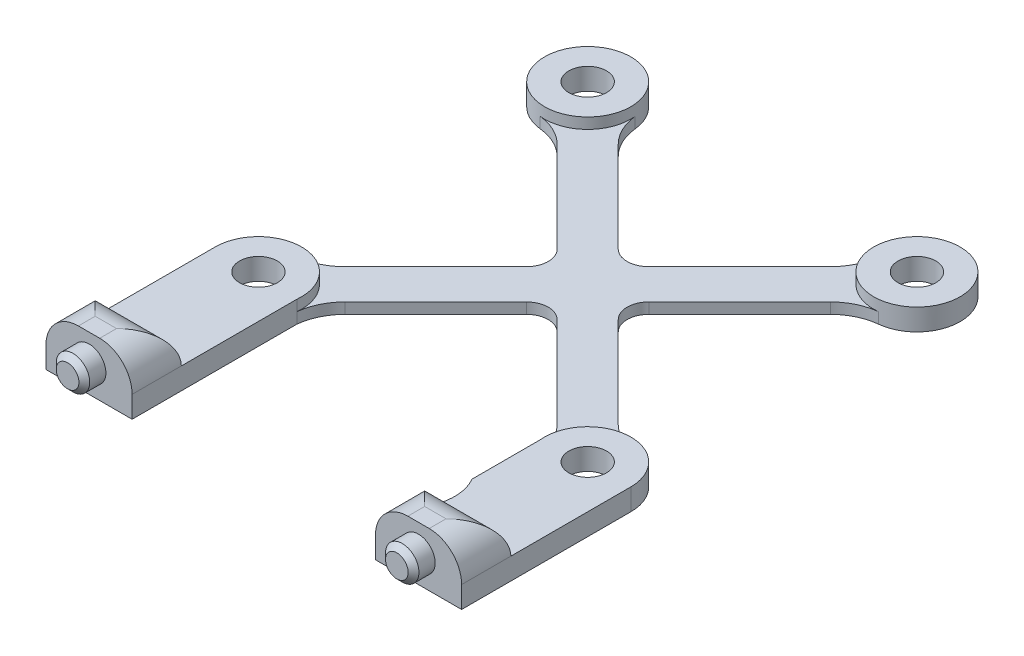
from build123d import *

# Parameters (mm, degrees)
SKETCH1_R           = 1.75
BOSS_EXTRUDE1_DEPTH = 1
SKETCH2_R           = 1.75
BOSS_EXTRUDE2_DEPTH = 1
FILLET1_R           = 5
FILLET2_R           = 2
BOSS_EXTRUDE3_REACH = 29.297
CUT_EXTRUDE1_REACH  = 38.486
SKETCH4_R           = 4.38
SKETCH5_W           = 7.977665541
SKETCH5_H           = 4.558516631
BOSS_EXTRUDE4_DEPTH = 3
SKETCH6_R           = 1.55
BOSS_EXTRUDE5_DEPTH = 2
FILLET3_R           = 3
CHAMFER1_SIZE       = 0.5


# Some blends are built 0.0001 mm under size
with BuildPart() as part:
    # Sketch1 → Boss-Extrude1 (new body)
    with BuildSketch(Plane(origin=(0, 0, 0), x_dir=(1, 0, 0), z_dir=(0, 1, 0))):
        with BuildLine():
            ThreePointArc((-11.386296695, 14.21472382), (-18.078427125, 18.078427125), (-14.21472382, 11.386296695))
            Line((-14.21472382, 11.386296695), (-2.828427125, 0))
            Line((-2.828427125, 0), (-14.21472382, -11.386296695))
            ThreePointArc((-14.21472382, -11.386296695), (-18.078427125, -18.078427125), (-11.386296695, -14.21472382))
            Line((-11.386296695, -14.21472382), (0, -2.828427125))
            Line((0, -2.828427125), (11.386296695, -14.21472382))
            ThreePointArc((11.386296695, -14.21472382), (18.078427125, -18.078427125), (14.21472382, -11.386296695))
            Line((14.21472382, -11.386296695), (2.828427125, 0))
            Line((2.828427125, 0), (14.21472382, 11.386296695))
            ThreePointArc((14.21472382, 11.386296695), (18.078427125, 18.078427125), (11.386296695, 14.21472382))
            Line((11.386296695, 14.21472382), (0, 2.828427125))
            Line((0, 2.828427125), (-11.386296695, 14.21472382))
        make_face()
        with Locations(Location((-15.25, -15.25, 0), (0, 0, 270))):
            Circle(SKETCH1_R, mode=Mode.SUBTRACT)
        with Locations(Location((15.25, -15.25, 0), (0, 0, 270))):
            Circle(SKETCH1_R, mode=Mode.SUBTRACT)
        with Locations(Location((-15.25, 15.25, 0), (0, 0, 270))):
            Circle(SKETCH1_R, mode=Mode.SUBTRACT)
        with Locations(Location((15.25, 15.25, 0), (0, 0, 270))):
            Circle(SKETCH1_R, mode=Mode.SUBTRACT)
    extrude(amount=BOSS_EXTRUDE1_DEPTH)

    # Sketch2 → Boss-Extrude2 (add)
    # profile 1 of 4: a face of its own
    with BuildSketch(Plane(origin=(0, 1, 0), x_dir=(1, 0, 0), z_dir=(0, 1, 0))):
        with BuildLine():
            ThreePointArc((-11.386296695, 14.21472382), (-11.284220555, 14.727895231), (-11.25, 15.25))
            ThreePointArc((-11.25, 15.25), (-18.423413361, 17.685045716), (-14.21472382, 11.386296695))
            ThreePointArc((-14.21472382, 11.386296695), (-12.421572875, 12.421572875), (-11.386296695, 14.21472382))
        make_face()
        with Locations(Location((-15.25, 15.25, 0), (0, 0, 270))):
            Circle(SKETCH2_R, mode=Mode.SUBTRACT)
    # profile 2 of 4: a face of its own
    with BuildSketch(Plane(origin=(0, 1, 0), x_dir=(1, 0, 0), z_dir=(0, 1, 0))):
        with BuildLine():
            ThreePointArc((-14.21472382, -11.386296695), (-18.423413361, -17.685045716), (-11.25, -15.25))
            ThreePointArc((-11.25, -15.25), (-11.284220555, -14.727895231), (-11.386296695, -14.21472382))
            ThreePointArc((-11.386296695, -14.21472382), (-12.421572875, -12.421572875), (-14.21472382, -11.386296695))
        make_face()
        with Locations(Location((-15.25, -15.25, 0), (0, 0, 270))):
            Circle(SKETCH2_R, mode=Mode.SUBTRACT)
    # profile 3 of 4: a face of its own
    with BuildSketch(Plane(origin=(0, 1, 0), x_dir=(1, 0, 0), z_dir=(0, 1, 0))):
        with BuildLine():
            ThreePointArc((11.386296695, -14.21472382), (14.727895231, -19.215779445), (19.25, -15.25))
            ThreePointArc((19.25, -15.25), (17.685045716, -12.076586639), (14.21472382, -11.386296695))
            ThreePointArc((14.21472382, -11.386296695), (12.421572875, -12.421572875), (11.386296695, -14.21472382))
        make_face()
        with Locations(Location((15.25, -15.25, 0), (0, 0, 270))):
            Circle(SKETCH2_R, mode=Mode.SUBTRACT)
    # profile 4 of 4: a face of its own
    with BuildSketch(Plane(origin=(0, 1, 0), x_dir=(1, 0, 0), z_dir=(0, 1, 0))):
        with BuildLine():
            ThreePointArc((14.21472382, 11.386296695), (17.685045716, 12.076586639), (19.25, 15.25))
            ThreePointArc((19.25, 15.25), (14.727895231, 19.215779445), (11.386296695, 14.21472382))
            ThreePointArc((11.386296695, 14.21472382), (12.421572875, 12.421572875), (14.21472382, 11.386296695))
        make_face()
        with Locations(Location((15.25, 15.25, 0), (0, 0, 270))):
            Circle(SKETCH2_R, mode=Mode.SUBTRACT)
    extrude(amount=BOSS_EXTRUDE2_DEPTH)

    # Fillet1
    # the kernel refuses this fillet: 5 mm, written as the material it adds along each edge
    with BuildSketch(Plane(origin=(-11.386296695, 0, -14.21472382), x_dir=(0.07795833957339635, 0, -0.9969566175571327), z_dir=(0, 1, 0))) as fillet1_piece_1:
        with BuildLine():
            CenterArc((2.375482021, -4.915816238), FILLET1_R, 100.528779366, 38.942441269)
            Line((-1.424916256, -1.666666667), (-1.500924222, -1.601683675))
            Line((-1.500924222, -1.601683675), (-0.076007966, 0.064982991))
            Line((-0.076007966, 0.064982991), (0.018272939, 0.098316325))
            ThreePointArc((0.018272939, 0.098316325), (0.730917545, 0.03265299), (1.443562151, 0.098316325))
            Line((1.443562151, 0.098316325), (1.46183509, 0))
        make_face()
    extrude(amount=1)
    with BuildSketch(Plane(origin=(11.386296695, 0, -14.21472382), x_dir=(-0.7071067811865598, 0, 0.7071067811865355), z_dir=(0, 1, 0))) as fillet1_piece_2:
        with BuildLine():
            CenterArc((2.192752634, -5), FILLET1_R, 90, 38.942441269)
            Line((-0.949944171, -1.111111111), (-1.012798107, -1.033333333))
            ThreePointArc((-1.012798107, -1.033333333), (-0.499790959, -0.534336666), (-0.08660254, 0.05))
            Line((-0.08660254, 0.05), (0, 0.1))
            Line((0, 0.1), (2.192752634, 0.1))
            Line((2.192752634, 0.1), (2.192752634, 0))
        make_face()
    extrude(amount=1)
    with BuildSketch(Plane(origin=(14.21472382, 0, -11.386296695), x_dir=(-0.7071067811865354, 0, 0.7071067811865597), z_dir=(0, 1, 0)), Plane(origin=(11.386296695, 0, 14.21472382), x_dir=(-0.7071067811865589, 0, -0.7071067811865362), z_dir=(0, 1, 0)), Plane(origin=(-14.21472382, 0, 11.386296695), x_dir=(0.707106781186535, 0, -0.7071067811865601), z_dir=(0, 1, 0))) as fillet1_piece_3:
        with BuildLine():
            CenterArc((2.192752634, 5), FILLET1_R, 231.057558731, 38.942441269)
            Line((-0.949944171, 1.111111111), (-1.012798107, 1.033333333))
            ThreePointArc((-1.012798107, 1.033333333), (-0.499790959, 0.534336666), (-0.08660254, -0.05))
            Line((-0.08660254, -0.05), (0, -0.1))
            Line((0, -0.1), (2.192752634, -0.1))
            Line((2.192752634, -0.1), (2.192752634, 0))
        make_face()
    extrude(amount=1)
    with BuildSketch(Plane(origin=(14.21472382, 0, 11.386296695), x_dir=(0.9969566175571322, 0, -0.07795833957340413), z_dir=(0, 1, 0)), Plane(origin=(-11.386296695, 0, 14.21472382), x_dir=(0.07795833957339876, 0, 0.9969566175571326), z_dir=(0, 1, 0)), Plane(origin=(-14.21472382, 0, -11.386296695), x_dir=(-0.9969566175571319, 0, 0.07795833957340663), z_dir=(0, 1, 0))) as fillet1_piece_4:
        with BuildLine():
            CenterArc((2.375482021, 4.915816238), FILLET1_R, 220.528779366, 38.942441269)
            Line((-1.424916256, 1.666666667), (-1.500924222, 1.601683675))
            Line((-1.500924222, 1.601683675), (-0.076007966, -0.064982991))
            Line((-0.076007966, -0.064982991), (0.018272939, -0.098316325))
            ThreePointArc((0.018272939, -0.098316325), (0.730917545, -0.03265299), (1.443562151, -0.098316325))
            Line((1.443562151, -0.098316325), (1.46183509, 0))
        make_face()
    extrude(amount=1)

    # Fillet2
    fillet2_edges = [part.edges().sort_by_distance(p)[0] for p in [
        (0, 0.5, -2.828427125),
        (2.828427125, 0.5, 0),
        (0, 0.5, 2.828427125),
        (-2.828427125, 0.5, 0),
    ]]
    fillet(fillet2_edges, radius=FILLET2_R)

    # Boss-Extrude3: up to this face of the body (flat: up to its plane)
    boss_extrude3_end = Plane(part.part.faces().sort_by_distance((11.363137085, 2, 15.25))[0])
    # Sketch3 → Boss-Extrude3 (add, up to the picked face)
    with BuildSketch(Plane.XZ, mode=Mode.PRIVATE) as boss_extrude3_sk1:
        with BuildLine():
            Line((-11.272334459, 30.93), (-19.25, 30.93))
            Line((-19.25, 30.93), (-19.25, 15.25))
            ThreePointArc((-19.25, 15.25), (-15.461350224, 19.244412483), (-11.272334459, 15.672109986))
            Line((-11.272334459, 15.672109986), (-11.272334459, 30.93))
        make_face()
    boss_extrude3_tool1 = split(extrude(boss_extrude3_sk1.sketch, amount=-BOSS_EXTRUDE3_REACH, mode=Mode.PRIVATE), bisect_by=boss_extrude3_end, keep=Keep.BOTH, mode=Mode.PRIVATE)
    # Sketch3 → Boss-Extrude3 (add, up to the picked face)
    with BuildSketch(Plane.XZ, mode=Mode.PRIVATE) as boss_extrude3_sk2:
        with BuildLine():
            Line((19.25, 30.93), (11.272334459, 30.93))
            Line((11.272334459, 30.93), (11.272334459, 15.672109986))
            ThreePointArc((11.272334459, 15.672109986), (15.461350224, 19.244412483), (19.25, 15.25))
            Line((19.25, 15.25), (19.25, 30.93))
        make_face()
    boss_extrude3_tool2 = split(extrude(boss_extrude3_sk2.sketch, amount=-BOSS_EXTRUDE3_REACH, mode=Mode.PRIVATE), bisect_by=boss_extrude3_end, keep=Keep.BOTH, mode=Mode.PRIVATE)
    add(boss_extrude3_tool1.solids().sort_by(Axis((-15.263723, 0, 24.633823), (0, 1, 0)))[0])
    add(boss_extrude3_tool2.solids().sort_by(Axis((15.263723, 0, 24.633823), (0, 1, 0)))[0])

    # Sketch4 → Cut-Extrude1 (cut, up to next)
    with BuildSketch(Plane(origin=(0, 2, 0), x_dir=(1, 0, 0), z_dir=(0, 1, 0)), mode=Mode.PRIVATE) as cut_extrude1_sk1:
        with Locations((7.48, -24.18)):
            Circle(SKETCH4_R)
    cut_extrude1_tool1 = extrude(cut_extrude1_sk1.sketch, amount=-CUT_EXTRUDE1_REACH, mode=Mode.PRIVATE) & part.part
    add(cut_extrude1_tool1.solids().sort_by_distance((7.48, 2, 24.18))[0], mode=Mode.SUBTRACT)

    # Sketch5 → Boss-Extrude4 (add)
    with BuildSketch(Plane(origin=(0, 2, 0), x_dir=(1, 0, 0), z_dir=(0, 1, 0))):
        with Locations((-15.261167229, -28.650741685)):
            Rectangle(SKETCH5_W, SKETCH5_H)
        with Locations((15.261167229, -28.650741685)):
            Rectangle(SKETCH5_W, SKETCH5_H)
    extrude(amount=BOSS_EXTRUDE4_DEPTH)

    # Sketch6 → Boss-Extrude5 (add)
    with BuildSketch(Plane.XY.offset(30.93)):
        with Locations(Location((-15.25, 2.5, 0), (0, 0, 180))):
            Circle(SKETCH6_R)
        with Locations(Location((15.25, 2.5, 0), (0, 0, 180))):
            Circle(SKETCH6_R)
    extrude(amount=BOSS_EXTRUDE5_DEPTH)

    # Fillet3
    fillet3_edges = [part.edges().sort_by_distance(p)[0] for p in [
        (19.25, 5, 28.650741684),
        (11.272334459, 5, 28.650741684),
        (-11.272334459, 5, 28.650741684),
        (-19.25, 5, 28.650741684),
        (15.261167229, 5, 26.371483369),
        (-15.261167229, 5, 26.371483369),
    ]]
    fillet(fillet3_edges, radius=FILLET3_R - 0.0001)  # a hair under: the kernel refuses the full size

    # Chamfer1
    chamfer1_edges = [part.edges().sort_by_distance(p)[0] for p in [
        (-13.7, 2.5, 32.93),
        (16.8, 2.5, 32.93),
    ]]
    chamfer(chamfer1_edges, length=CHAMFER1_SIZE)


solid = part.part
